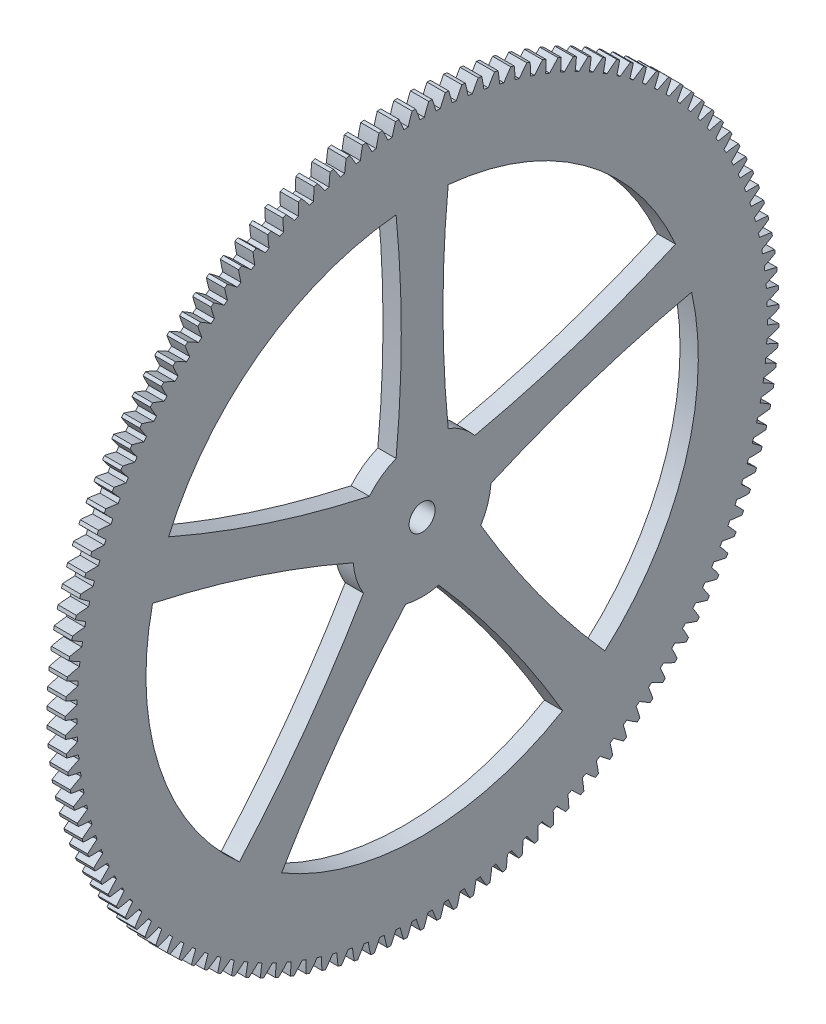
from build123d import *

# Parameters (mm, degrees)
BASPROSKE_W        = 4.445
BASPROSKE_H        = 86.995
TOOTHCUT_DEPTH     = 124.109780582
TEETHCUTS_COUNT    = 135
TEETHCUTS_ANGLE    = 357.333333333
BORSKE_R           = 3.175
BORE_DEPTH         = 50.8000508
CUT_EXTRUDE1_DEPTH = 124.108379997


with BuildPart() as part:
    # BasProSke → Base-Revolve (revolve)
    with BuildSketch(Plane(origin=(0, 0, 0), x_dir=(1, 0, 0), z_dir=(0, 1, 0))):
        with Locations((2.2225, 43.4975)):
            Rectangle(BASPROSKE_W, BASPROSKE_H)
    revolve(axis=Axis((-10, 0, 0), (1, 0, 0)))

    # TooCutSke → ToothCut (cut, through all)
    with BuildSketch(Plane(origin=(0, 0, 0), x_dir=(0, 0, -1), z_dir=(1, 0, 0))):
        with BuildLine():
            ThreePointArc((0.527726426, 84.148545233), (0, 84.1502), (-0.527726426, 84.148545233))
            ThreePointArc((-0.527726426, 84.148545233), (-1.03714453, 85.589085102), (-1.61023131, 87.005500811))
            ThreePointArc((-1.61023131, 87.005500811), (0, 87.0204), (1.61023131, 87.005500811))
            ThreePointArc((1.61023131, 87.005500811), (1.03714453, 85.589085102), (0.527726426, 84.148545233))
        make_face()
    toothcut = extrude(amount=TOOTHCUT_DEPTH, mode=Mode.SUBTRACT)

    # TeethCuts: ToothCut ×135 about axis
    teethcuts_axis = Axis((-10, 0, 0), (1, 0, 0))
    for i in range(1, TEETHCUTS_COUNT):
        add(toothcut.rotate(teethcuts_axis, i * TEETHCUTS_ANGLE / (TEETHCUTS_COUNT - 1)), mode=Mode.SUBTRACT)

    # BorSke → Bore (cut, symmetric)
    with BuildSketch(Plane(origin=(0, 0, 0), x_dir=(0, 0, -1), z_dir=(1, 0, 0))):
        Circle(BORSKE_R)
    extrude(amount=BORE_DEPTH, both=True, mode=Mode.SUBTRACT)

    # Sketch1 → Cut-Extrude1 (cut, through all)
    with BuildSketch(Plane.ZY):
        with BuildLine():
            ThreePointArc((61.777557204, 26.749530245), (39.56979723, 54.463153504), (6.35, 67.020007777))
            ThreePointArc((6.35, 67.020007777), (5.08, 41.303073669), (6.35, 15.586139561))
            ThreePointArc((6.35, 15.586139561), (9.892449307, 13.615788376), (12.861041679, 10.855590879))
            ThreePointArc((12.861041679, 10.855590879), (37.711751024, 17.594718786), (61.777557204, 26.749530245))
        make_face()
        with BuildLine():
            ThreePointArc((-6.35, 15.586139561), (-5.08, 41.303073669), (-6.35, 67.020007777))
            ThreePointArc((-6.35, 67.020007777), (-39.56979723, 54.463153504), (-61.777557204, 26.749530245))
            ThreePointArc((-61.777557204, 26.749530245), (-37.711751024, 17.594718786), (-12.861041679, 10.855590879))
            ThreePointArc((-12.861041679, 10.855590879), (-9.892449307, 13.615788376), (-6.35, 15.586139561))
        make_face()
        with BuildLine():
            ThreePointArc((65.702073033, 14.671112488), (40.851363687, 7.931984581), (16.785557507, -1.222826878))
            ThreePointArc((16.785557507, -1.222826878), (16.006319212, -5.200768376), (14.298560888, -8.877015429))
            ThreePointArc((14.298560888, -8.877015429), (28.387143908, -30.428939436), (44.530630094, -50.487888903))
            ThreePointArc((44.530630094, -50.487888903), (64.025276846, -20.803073504), (65.702073033, 14.671112488))
        make_face()
        with BuildLine():
            ThreePointArc((-16.785557507, -1.222826878), (-40.851363687, 7.931984581), (-65.702073033, 14.671112488))
            ThreePointArc((-65.702073033, 14.671112488), (-64.025276846, -20.803073504), (-44.530630094, -50.487888903))
            ThreePointArc((-44.530630094, -50.487888903), (-28.387143908, -30.428939436), (-14.298560888, -8.877015429))
            ThreePointArc((-14.298560888, -8.877015429), (-16.006319212, -5.200768376), (-16.785557507, -1.222826878))
        make_face()
        with BuildLine():
            ThreePointArc((-4.02404506, -16.341888133), (-20.167531245, -36.4008376), (-34.256114266, -57.952761607))
            ThreePointArc((-34.256114266, -57.952761607), (0, -67.32016), (34.256114266, -57.952761607))
            ThreePointArc((34.256114266, -57.952761607), (20.167531245, -36.4008376), (4.02404506, -16.341888133))
            ThreePointArc((4.02404506, -16.341888133), (0, -16.83004), (-4.02404506, -16.341888133))
        make_face()
    extrude(amount=-CUT_EXTRUDE1_DEPTH, mode=Mode.SUBTRACT)


solid = part.part
